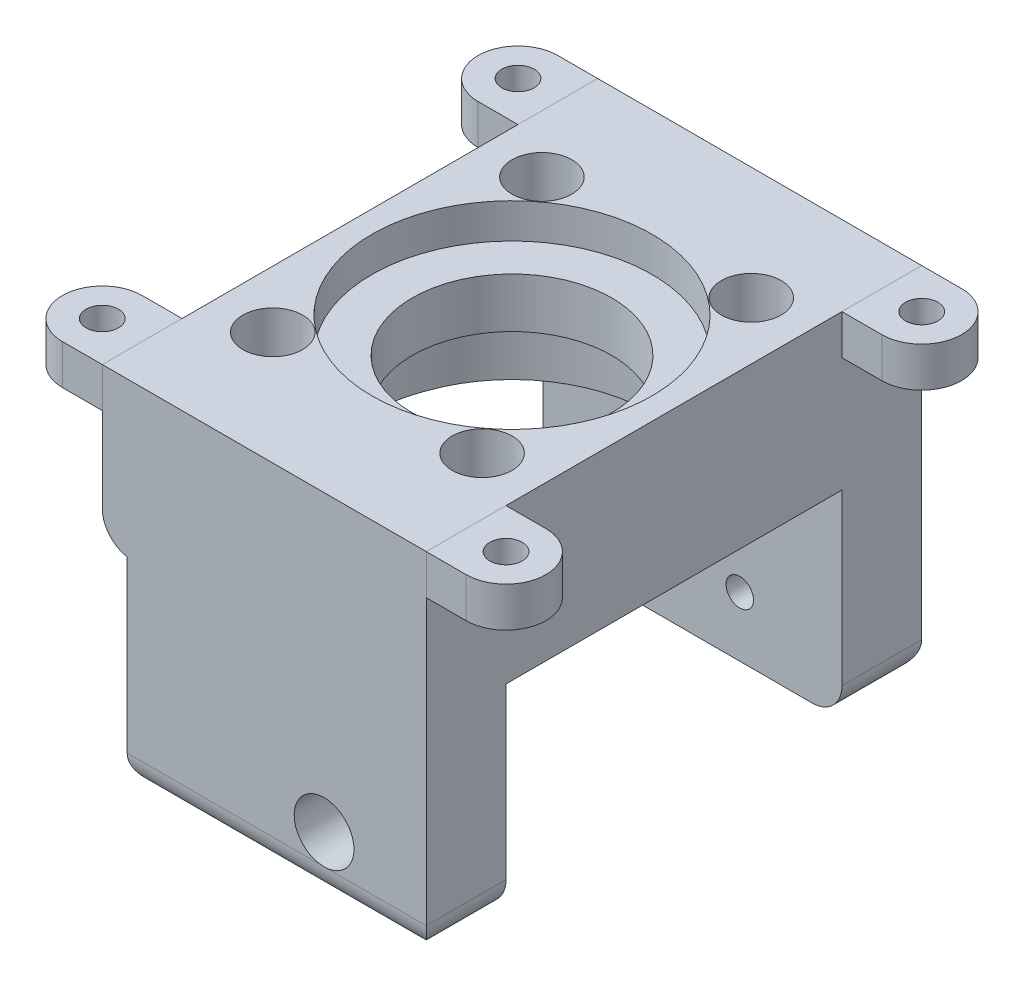
from build123d import *

# Parameters (mm, degrees)
SKETCH1_R             = 1.375
SKETCH1_R_2           = 1.460845326
SKETCH1_R_3           = 1.480655282
BOSS_EXTRUDE1_DEPTH   = 15
BOSS_EXTRUDE2_START   = -8
SKETCH2_R             = 14
SKETCH2_R_2           = 10
BOSS_EXTRUDE2_DEPTH   = 8
CUT_EXTRUDE1_START    = -3
SKETCH3_R             = 14
SKETCH3_R_2           = 10
CUT_EXTRUDE1_DEPTH    = 3
SKETCH5_R             = 1.480655282
SKETCH5_R_2           = 1.375
SKETCH5_R_3           = 1.460845326
BOSS_EXTRUDE3_DEPTH   = 0.5
BOSS_EXTRUDE4_DEPTH   = 5
SKETCH7_R             = 3
CUT_EXTRUDE2_DEPTH    = 12.5
SKETCH8_R             = 14.05
CUT_EXTRUDE3_DEPTH    = 3.5
SKETCH9_W             = 30
SKETCH9_H             = 8
BOSS_EXTRUDE6_DEPTH   = 20
BOSS_EXTRUDE6_2_DEPTH = 20
SKETCH10_W            = 30
SKETCH10_H            = 8
BOSS_EXTRUDE7_DEPTH   = 15.5
BOSS_EXTRUDE14_DEPTH  = 15.5
CUT_EXTRUDE11_START   = 15.5
SKETCH16_R            = 14.05
CUT_EXTRUDE11_DEPTH   = 15.5
SKETCH17_R            = 4
SKETCH17_R_2          = 1.625
BOSS_EXTRUDE15_DEPTH  = 4
SKETCH18_R            = 1.375
CUT_EXTRUDE12_DEPTH   = 55.5
SKETCH19_R            = 3
CUT_EXTRUDE13_DEPTH   = 5
CUT_EXTRUDE14_START   = -5
SKETCH20_R            = 3
CUT_EXTRUDE14_DEPTH   = 5
FILLET1_R             = 3
FILLET2_R             = 3


# Some blends are built 0.0001 mm under size
with BuildPart() as part:
    # Sketch1 → Boss-Extrude1 (new body)
    with BuildSketch(Plane(origin=(0, 0, 0), x_dir=(1, 0, 0), z_dir=(0, 1, 0))):
        with BuildLine():
            Line((-15, -16.85), (15, -16.85))
            Line((15, -16.85), (15, 16.85))
            Line((15, 16.85), (-15, 16.85))
            Line((-15, 16.85), (-15, 2.633913438))
            ThreePointArc((-15, 2.633913438), (0.072875656, 13.937359865), (12.75, 0))
            ThreePointArc((12.75, 0), (0.072875656, -13.937359865), (-15, -2.633913438))
            Line((-15, -2.633913438), (-15, -16.85))
        make_face()
        with Locations(Location((-11.75, -13.5, 0), (0, 0, 270))):
            Circle(SKETCH1_R, mode=Mode.SUBTRACT)
        with Locations(Location((9.25, -13.5, 0), (0, 0, 270))):
            Circle(SKETCH1_R_2, mode=Mode.SUBTRACT)
        with Locations(Location((-11.75, 13.5, 0), (0, 0, 270))):
            Circle(SKETCH1_R, mode=Mode.SUBTRACT)
        with Locations(Location((9.25, 13.5, 0), (0, 0, 270))):
            Circle(SKETCH1_R_3, mode=Mode.SUBTRACT)
    extrude(amount=BOSS_EXTRUDE1_DEPTH)

    # Sketch2 → Boss-Extrude2 (add)
    with BuildSketch(Plane(origin=(0, 15, 0), x_dir=(1, 0, 0), z_dir=(0, 1, 0)).offset(BOSS_EXTRUDE2_START)):
        with Locations((-1.25, 0)):
            Circle(SKETCH2_R)
        with Locations(Location((-1.25, 0, 0), (0, 0, 270))):
            Circle(SKETCH2_R_2, mode=Mode.SUBTRACT)
    extrude(amount=BOSS_EXTRUDE2_DEPTH)

    # Sketch3 → Cut-Extrude1 (cut)
    with BuildSketch(Plane(origin=(0, 15, 0), x_dir=(1, 0, 0), z_dir=(0, 1, 0)).offset(CUT_EXTRUDE1_START)):
        with Locations((-1.25, 0)):
            Circle(SKETCH3_R)
        with Locations(Location((-1.25, 0, 0), (0, 0, 270))):
            Circle(SKETCH3_R_2, mode=Mode.SUBTRACT)
    extrude(amount=CUT_EXTRUDE1_DEPTH, mode=Mode.SUBTRACT)

    # Sketch5 → Boss-Extrude3 (add)
    with BuildSketch(Plane(origin=(0, 15, 0), x_dir=(1, 0, 0), z_dir=(0, 1, 0))):
        with BuildLine():
            Line((-15, 16.85), (-15, 2.633913438))
            ThreePointArc((-15, 2.633913438), (12.75, 0), (-15, -2.633913438))
            Line((-15, -2.633913438), (-15, -16.85))
            Line((-15, -16.85), (15, -16.85))
            Line((15, -16.85), (15, 16.85))
            Line((15, 16.85), (-15, 16.85))
        make_face()
        with Locations(Location((9.25, 13.5, 0), (0, 0, 270))):
            Circle(SKETCH5_R, mode=Mode.SUBTRACT)
        with Locations(Location((-11.75, -13.5, 0), (0, 0, 270))):
            Circle(SKETCH5_R_2, mode=Mode.SUBTRACT)
        with Locations(Location((-11.75, 13.5, 0), (0, 0, 270))):
            Circle(SKETCH5_R_2, mode=Mode.SUBTRACT)
        with Locations(Location((9.25, -13.5, 0), (0, 0, 270))):
            Circle(SKETCH5_R_3, mode=Mode.SUBTRACT)
    extrude(amount=BOSS_EXTRUDE3_DEPTH)

    # Sketch6 → Boss-Extrude4 (add)
    with BuildSketch(Plane(origin=(0, 15.5, 0), x_dir=(1, 0, 0), z_dir=(0, 1, 0))):
        with BuildLine():
            ThreePointArc((-1.625, 20.35), (0, 21.975), (1.625, 20.35))
            Line((1.625, 20.35), (3.5, 20.35))
            ThreePointArc((3.5, 20.35), (0, 23.85), (-3.5, 20.35))
            Line((-3.5, 20.35), (-1.625, 20.35))
        make_face()
        with BuildLine():
            Line((3.5, 20.35), (1.625, 20.35))
            ThreePointArc((1.625, 20.35), (0, 18.725), (-1.625, 20.35))
            Line((-1.625, 20.35), (-3.5, 20.35))
            ThreePointArc((-3.5, 20.35), (-2.474873743, 17.875126275), (-2.6e-08, 16.85))
            ThreePointArc((-2.6e-08, 16.85), (2.474873725, 17.875126257), (3.5, 20.35))
        make_face()
        with BuildLine():
            Line((3.5, 16.85), (3.5, 20.35))
            ThreePointArc((3.5, 20.35), (2.474873725, 17.875126257), (-2.6e-08, 16.85))
            Line((-2.6e-08, 16.85), (3.5, 16.85))
        make_face()
        with BuildLine():
            ThreePointArc((-2.6e-08, 16.85), (-2.474873743, 17.875126275), (-3.5, 20.35))
            Line((-3.5, 20.35), (-3.5, 16.85))
            Line((-3.5, 16.85), (-2.6e-08, 16.85))
        make_face()
        with BuildLine():
            ThreePointArc((-3.5, -20.35), (-2.474873734, -17.875126266), (0, -16.85))
            Line((0, -16.85), (-3.5, -16.85))
            Line((-3.5, -16.85), (-3.5, -20.35))
        make_face()
        with BuildLine():
            Line((3.5, -20.35), (3.5, -16.85))
            Line((3.5, -16.85), (0, -16.85))
            ThreePointArc((0, -16.85), (2.474873734, -17.875126266), (3.5, -20.35))
        make_face()
        with BuildLine():
            ThreePointArc((-3.5, -20.35), (0, -23.85), (3.5, -20.35))
            Line((3.5, -20.35), (1.625, -20.35))
            ThreePointArc((1.625, -20.35), (0, -21.975), (-1.625, -20.35))
            Line((-1.625, -20.35), (-3.5, -20.35))
        make_face()
        with BuildLine():
            Line((1.625, -20.35), (3.5, -20.35))
            ThreePointArc((3.5, -20.35), (2.474873734, -17.875126266), (0, -16.85))
            ThreePointArc((0, -16.85), (-2.474873734, -17.875126266), (-3.5, -20.35))
            Line((-3.5, -20.35), (-1.625, -20.35))
            ThreePointArc((-1.625, -20.35), (0, -18.725), (1.625, -20.35))
        make_face()
    extrude(amount=-BOSS_EXTRUDE4_DEPTH)

    # Sketch7 → Cut-Extrude2 (cut)
    with BuildSketch(Plane(origin=(0, 15.5, 0), x_dir=(1, 0, 0), z_dir=(0, 1, 0))):
        with Locations(Location((-11.75, 13.5, 0), (0, 0, 270))):
            Circle(SKETCH7_R)
        with Locations(Location((9.25, 13.5, 0), (0, 0, 270))):
            Circle(SKETCH7_R)
        with Locations(Location((9.25, -13.5, 0), (0, 0, 270))):
            Circle(SKETCH7_R)
        with Locations(Location((-11.75, -13.5, 0), (0, 0, 270))):
            Circle(SKETCH7_R)
    extrude(amount=-CUT_EXTRUDE2_DEPTH, mode=Mode.SUBTRACT)

    # Sketch8 → Cut-Extrude3 (cut)
    with BuildSketch(Plane(origin=(0, 15.5, 0), x_dir=(1, 0, 0), z_dir=(0, 1, 0))):
        with Locations((-1.25, 0)):
            Circle(SKETCH8_R)
    extrude(amount=-CUT_EXTRUDE3_DEPTH, mode=Mode.SUBTRACT)



with BuildPart() as body_2:
    # Sketch9 → Boss-Extrude6 (new body)
    with BuildSketch(Plane.XZ):
        with Locations((0, 20.85)):
            Rectangle(SKETCH9_W, SKETCH9_H)
    extrude(amount=BOSS_EXTRUDE6_DEPTH)


with BuildPart() as body_3:
    # Sketch9 → Boss-Extrude6 2 (new body)
    with BuildSketch(Plane.XZ):
        with Locations((0, -20.85)):
            Rectangle(SKETCH9_W, SKETCH9_H)
    extrude(amount=BOSS_EXTRUDE6_2_DEPTH)


with BuildPart() as part_1:
    add(part.part)

    add(body_2.part)  # Boss-Extrude7 merges body 2

    add(body_3.part)  # Boss-Extrude7 merges body 3
    # Sketch10 → Boss-Extrude7 (add)
    with BuildSketch(Plane(origin=(0, 0, 0), x_dir=(1, 0, 0), z_dir=(0, 1, 0))):
        with Locations((0, 20.85)):
            Rectangle(SKETCH10_W, SKETCH10_H)
        with Locations((0, -20.85)):
            Rectangle(SKETCH10_W, SKETCH10_H)
    extrude(amount=BOSS_EXTRUDE7_DEPTH)

    # Sketch15 → Boss-Extrude14 (add)
    with BuildSketch(Plane.XZ):
        with BuildLine():
            Line((-15, 24.85), (-17.5, 24.85))
            Line((-17.5, 24.85), (-17.5, -24.85))
            Line((-17.5, -24.85), (-15, -24.85))
            Line((-15, -24.85), (-15, -16.85))
            Line((-15, -16.85), (-15, -2.633913438))
            ThreePointArc((-15, -2.633913438), (-15.25, 0), (-15, 2.633913438))
            Line((-15, 2.633913438), (-15, 16.85))
            Line((-15, 16.85), (-15, 24.85))
        make_face()
    extrude(amount=-BOSS_EXTRUDE14_DEPTH)

    # Sketch16 → Cut-Extrude11 (cut)
    with BuildSketch(Plane(origin=(0, 12, 0), x_dir=(1, 0, 0), z_dir=(0, 1, 0)).offset(CUT_EXTRUDE11_START)):
        with Locations(Location((-1.25, 0, 0), (0, 0, 270))):
            Circle(SKETCH16_R)
    extrude(amount=-CUT_EXTRUDE11_DEPTH, mode=Mode.SUBTRACT)

    # Sketch18 → Cut-Extrude12 (cut)
    with BuildSketch(Plane(origin=(0, 0, -24.85), x_dir=(-1, 0, 0), z_dir=(0, 0, -1))):
        with Locations((-4.75, -14)):
            Circle(SKETCH18_R)
    extrude(amount=-CUT_EXTRUDE12_DEPTH, mode=Mode.SUBTRACT)

    # Sketch19 → Cut-Extrude13 (cut)
    with BuildSketch(Plane.XY.offset(24.85)):
        with Locations((4.75, -14)):
            Circle(SKETCH19_R)
    extrude(amount=-CUT_EXTRUDE13_DEPTH, mode=Mode.SUBTRACT)

    # Sketch20 → Cut-Extrude14 (cut)
    with BuildSketch(Plane(origin=(0, 0, -24.85), x_dir=(-1, 0, 0), z_dir=(0, 0, -1)).offset(CUT_EXTRUDE14_START)):
        with Locations(Location((-4.75, -14, 0), (0, 0, 180))):
            Circle(SKETCH20_R)
    extrude(amount=CUT_EXTRUDE14_DEPTH, mode=Mode.SUBTRACT)

    # Fillet1
    # the kernel refuses this fillet: 3 mm, written as the material it takes off along each edge
    with BuildSketch(Plane(origin=(-17.5, 0, 32.35), x_dir=(1, 0, 0), z_dir=(0, 0, -1))) as fillet1_piece_1_section:
        with BuildLine():
            CenterArc((FILLET1_R, -FILLET1_R), FILLET1_R, 90, 90)
            Line((0, -FILLET1_R), (0, 0))
            Line((0, 0), (FILLET1_R, 0))
        make_face()
    fillet1_piece_1 = extrude(amount=64.7, mode=Mode.PRIVATE)
    fillet1_piece_1 = split(fillet1_piece_1, bisect_by=Plane(origin=(-15, 0.690666213, 24.6), z_dir=(-1, 0, 0)), keep=Keep.TOP, mode=Mode.PRIVATE)
    fillet1_piece_1 = split(fillet1_piece_1, bisect_by=Plane(origin=(-16.854336026, 0.690666213, 16.85), z_dir=(0, 0, 1)), keep=Keep.TOP, mode=Mode.PRIVATE)
    add(fillet1_piece_1, mode=Mode.SUBTRACT)
    with BuildSketch(Plane(origin=(-17.5, 0, 32.35), x_dir=(1, 0, 0), z_dir=(0, 0, -1))) as fillet1_piece_2_section:
        with BuildLine():
            CenterArc((FILLET1_R, -FILLET1_R), FILLET1_R, 90, 90)
            Line((0, -FILLET1_R), (0, 0))
            Line((0, 0), (FILLET1_R, 0))
        make_face()
    fillet1_piece_2 = extrude(amount=64.7, mode=Mode.PRIVATE)
    fillet1_piece_2 = split(fillet1_piece_2, bisect_by=Plane(origin=(-15, -0.021970268, 0), z_dir=(1, 0, 0)), keep=Keep.TOP, mode=Mode.PRIVATE)
    fillet1_piece_2 = split(fillet1_piece_2, bisect_by=Plane(origin=(-14.773609576, -0.021970268, 16.85), z_dir=(0, 0, -1)), keep=Keep.TOP, mode=Mode.PRIVATE)
    fillet1_piece_2 = split(fillet1_piece_2, bisect_by=Plane(origin=(-14.773609576, -0.021970268, -16.85), z_dir=(0, 0, 1)), keep=Keep.TOP, mode=Mode.PRIVATE)
    add(fillet1_piece_2, mode=Mode.SUBTRACT)
    with BuildSketch(Plane(origin=(-17.5, 0, 32.35), x_dir=(1, 0, 0), z_dir=(0, 0, -1))) as fillet1_piece_3_section:
        with BuildLine():
            CenterArc((FILLET1_R, -FILLET1_R), FILLET1_R, 90, 90)
            Line((0, -FILLET1_R), (0, 0))
            Line((0, 0), (FILLET1_R, 0))
        make_face()
    fillet1_piece_3 = extrude(amount=64.7, mode=Mode.PRIVATE)
    fillet1_piece_3 = split(fillet1_piece_3, bisect_by=Plane(origin=(-15, 0.690666213, 0), z_dir=(-1, 0, 0)), keep=Keep.TOP, mode=Mode.PRIVATE)
    fillet1_piece_3 = split(fillet1_piece_3, bisect_by=Plane(origin=(-16.854336026, 0.690666213, 16.85), z_dir=(0, 0, -1)), keep=Keep.TOP, mode=Mode.PRIVATE)
    fillet1_piece_3 = split(fillet1_piece_3, bisect_by=Plane(origin=(-16.854336026, 0.690666213, -16.85), z_dir=(0, 0, 1)), keep=Keep.TOP, mode=Mode.PRIVATE)
    add(fillet1_piece_3, mode=Mode.SUBTRACT)
    with BuildSketch(Plane(origin=(-17.5, 0, 32.35), x_dir=(1, 0, 0), z_dir=(0, 0, -1))) as fillet1_piece_4_section:
        with BuildLine():
            CenterArc((FILLET1_R, -FILLET1_R), FILLET1_R, 90, 90)
            Line((0, -FILLET1_R), (0, 0))
            Line((0, 0), (FILLET1_R, 0))
        make_face()
    fillet1_piece_4 = extrude(amount=64.7, mode=Mode.PRIVATE)
    fillet1_piece_4 = split(fillet1_piece_4, bisect_by=Plane(origin=(-15, 0.690666213, -24.6), z_dir=(-1, 0, 0)), keep=Keep.TOP, mode=Mode.PRIVATE)
    fillet1_piece_4 = split(fillet1_piece_4, bisect_by=Plane(origin=(-16.854336026, 0.690666213, -16.85), z_dir=(0, 0, -1)), keep=Keep.TOP, mode=Mode.PRIVATE)
    add(fillet1_piece_4, mode=Mode.SUBTRACT)

    # Fillet2
    fillet2_edges = [part_1.edges().sort_by_distance(p)[0] for p in [
        (15, -20, -20.85),
        (-15, -20, -20.85),
        (0, -20, -24.85),
        (15, -20, 20.85),
        (0, -20, 24.85),
        (-15, -20, 20.85),
    ]]
    fillet(fillet2_edges, radius=FILLET2_R - 0.0001)  # a hair under: the kernel refuses the full size


with BuildPart() as body_2_2:
    # Sketch17 → Boss-Extrude15 (new body)
    # profile 1 of 12: a face of its own
    with BuildSketch(Plane(origin=(0, 15.5, 0), x_dir=(1, 0, 0), z_dir=(0, 1, 0))):
        with Locations((-21.5, 20.85)):
            Circle(SKETCH17_R)
        with Locations(Location((-21.5, 20.85, 0), (0, 0, 270))):
            Circle(SKETCH17_R_2, mode=Mode.SUBTRACT)
    # profile 2 of 12: a face of its own
    with BuildSketch(Plane(origin=(0, 15.5, 0), x_dir=(1, 0, 0), z_dir=(0, 1, 0))):
        with BuildLine():
            Line((-17.5, -20.85), (-17.5, -16.85))
            Line((-17.5, -16.85), (-21.5, -16.85))
            ThreePointArc((-21.5, -16.85), (-18.671572875, -18.021572875), (-17.5, -20.85))
        make_face()
    # profile 3 of 12: a face of its own
    with BuildSketch(Plane(origin=(0, 15.5, 0), x_dir=(1, 0, 0), z_dir=(0, 1, 0))):
        with BuildLine():
            Line((-17.5, -24.85), (-17.5, -20.85))
            ThreePointArc((-17.5, -20.85), (-18.671572875, -23.678427125), (-21.5, -24.85))
            Line((-21.5, -24.85), (-17.5, -24.85))
        make_face()
    # profile 4 of 12: a face of its own
    with BuildSketch(Plane(origin=(0, 15.5, 0), x_dir=(1, 0, 0), z_dir=(0, 1, 0))):
        with Locations((-21.5, -20.85)):
            Circle(SKETCH17_R)
        with Locations(Location((-21.5, -20.85, 0), (0, 0, 270))):
            Circle(SKETCH17_R_2, mode=Mode.SUBTRACT)
    # profile 5 of 12: a face of its own
    with BuildSketch(Plane(origin=(0, 15.5, 0), x_dir=(1, 0, 0), z_dir=(0, 1, 0))):
        with BuildLine():
            Line((19, -16.85), (15, -16.85))
            Line((15, -16.85), (15, -20.85))
            ThreePointArc((15, -20.85), (16.171572875, -18.021572875), (19, -16.85))
        make_face()
    # profile 6 of 12: a face of its own
    with BuildSketch(Plane(origin=(0, 15.5, 0), x_dir=(1, 0, 0), z_dir=(0, 1, 0))):
        with Locations((19, -20.85)):
            Circle(SKETCH17_R)
        with Locations(Location((19, -20.85, 0), (0, 0, 270))):
            Circle(SKETCH17_R_2, mode=Mode.SUBTRACT)
    # profile 7 of 12: a face of its own
    with BuildSketch(Plane(origin=(0, 15.5, 0), x_dir=(1, 0, 0), z_dir=(0, 1, 0))):
        with BuildLine():
            ThreePointArc((19, -24.85), (16.171572875, -23.678427125), (15, -20.85))
            Line((15, -20.85), (15, -24.85))
            Line((15, -24.85), (19, -24.85))
        make_face()
    # profile 8 of 12: a face of its own
    with BuildSketch(Plane(origin=(0, 15.5, 0), x_dir=(1, 0, 0), z_dir=(0, 1, 0))):
        with Locations((19, 20.85)):
            Circle(SKETCH17_R)
        with Locations(Location((19, 20.85, 0), (0, 0, 270))):
            Circle(SKETCH17_R_2, mode=Mode.SUBTRACT)
    # profile 9 of 12: a face of its own
    with BuildSketch(Plane(origin=(0, 15.5, 0), x_dir=(1, 0, 0), z_dir=(0, 1, 0))):
        with BuildLine():
            Line((19, 24.85), (15, 24.85))
            Line((15, 24.85), (15, 20.85))
            ThreePointArc((15, 20.85), (16.171572875, 23.678427125), (19, 24.85))
        make_face()
    # profile 10 of 12: a face of its own
    with BuildSketch(Plane(origin=(0, 15.5, 0), x_dir=(1, 0, 0), z_dir=(0, 1, 0))):
        with BuildLine():
            ThreePointArc((19, 16.85), (16.171572875, 18.021572875), (15, 20.85))
            Line((15, 20.85), (15, 16.85))
            Line((15, 16.85), (19, 16.85))
        make_face()
    # profile 11 of 12: a face of its own
    with BuildSketch(Plane(origin=(0, 15.5, 0), x_dir=(1, 0, 0), z_dir=(0, 1, 0))):
        with BuildLine():
            Line((-17.5, 16.85), (-17.5, 20.85))
            ThreePointArc((-17.5, 20.85), (-18.671572875, 18.021572875), (-21.5, 16.85))
            Line((-21.5, 16.85), (-17.5, 16.85))
        make_face()
    # profile 12 of 12: a face of its own
    with BuildSketch(Plane(origin=(0, 15.5, 0), x_dir=(1, 0, 0), z_dir=(0, 1, 0))):
        with BuildLine():
            Line((-17.5, 24.85), (-21.5, 24.85))
            ThreePointArc((-21.5, 24.85), (-18.671572875, 23.678427125), (-17.5, 20.85))
            Line((-17.5, 20.85), (-17.5, 24.85))
        make_face()
    extrude(amount=-BOSS_EXTRUDE15_DEPTH)


solid = Compound([part_1.part, body_2_2.part])
